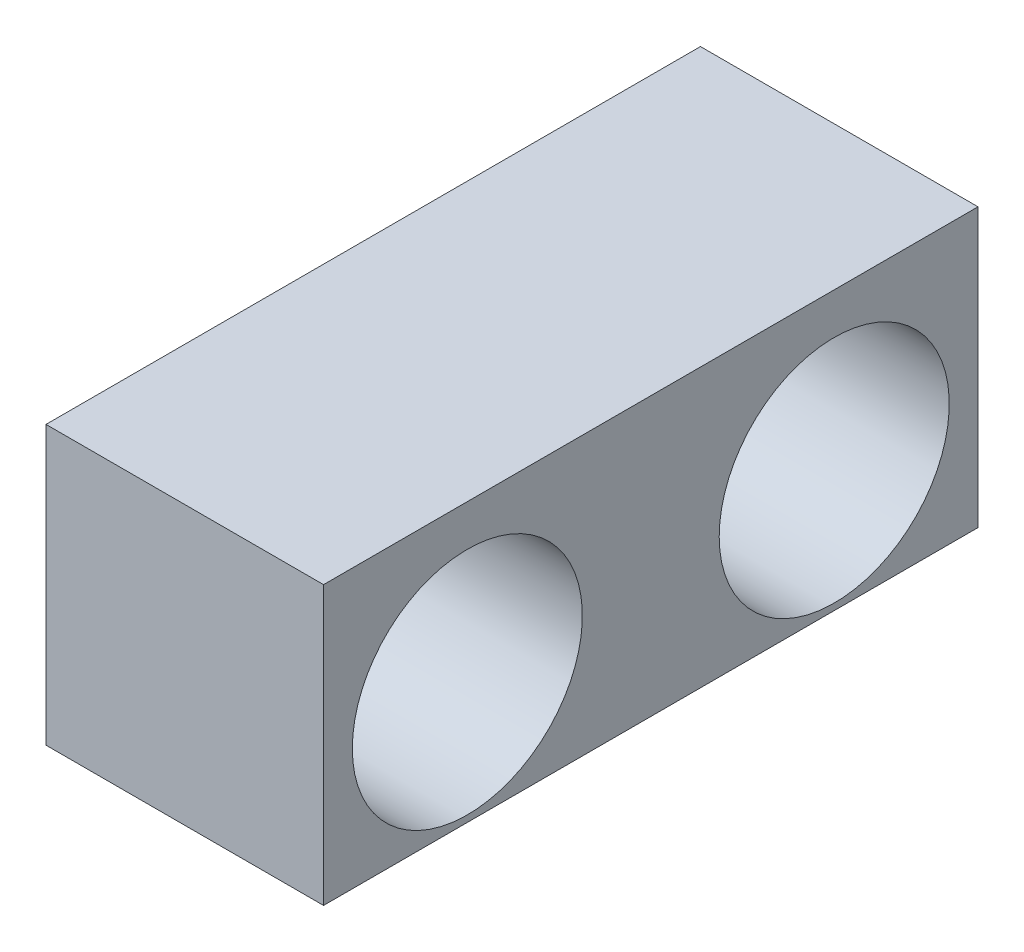
from build123d import *

# Parameters (mm, degrees)
SKETCH1_R           = 75
BOSS_EXTRUDE1_DEPTH = 100
SKETCH2_OUTSIDE_W   = 198.904
SKETCH2_OUTSIDE_H   = 198.904
SKETCH2_OUTSIDE_W_2 = 44.4
SKETCH2_OUTSIDE_H_2 = 104.689862838
CUT_EXTRUDE1_DEPTH  = 146.773797371
SKETCH3_W           = 44.4
SKETCH3_H           = 55.555068581
CUT_EXTRUDE2_DEPTH  = 147.467769086
SKETCH4_R           = 18.4
CUT_EXTRUDE3_DEPTH  = 82.772267757


with BuildPart() as part:
    # Sketch1 → Boss-Extrude1 (new body)
    with BuildSketch(Plane(origin=(0, 0, 0), x_dir=(1, 0, 0), z_dir=(0, 1, 0))):
        Circle(SKETCH1_R)
    extrude(amount=BOSS_EXTRUDE1_DEPTH)

    # Sketch2 outside → Cut-Extrude1 (cut, through all)
    with BuildSketch(Plane(origin=(0, 100, 0), x_dir=(1, 0, 0), z_dir=(0, 1, 0))):
        Rectangle(SKETCH2_OUTSIDE_W, SKETCH2_OUTSIDE_H)
        Rectangle(SKETCH2_OUTSIDE_W_2, SKETCH2_OUTSIDE_H_2, mode=Mode.SUBTRACT)
    extrude(amount=-CUT_EXTRUDE1_DEPTH, mode=Mode.SUBTRACT)

    # Sketch3 → Cut-Extrude2 (cut, through all)
    with BuildSketch(Plane.XY.offset(52.344931419)):
        with Locations((0, 72.222465709)):
            Rectangle(SKETCH3_W, SKETCH3_H)
    extrude(amount=-CUT_EXTRUDE2_DEPTH, mode=Mode.SUBTRACT)

    # Sketch4 → Cut-Extrude3 (cut, through all)
    with BuildSketch(Plane.ZY.offset(22.2)):
        with Locations((29.344931419, 19.444931419)):
            Circle(SKETCH4_R)
        with Locations((-29.344931419, 19.444931419)):
            Circle(SKETCH4_R)
    extrude(amount=-CUT_EXTRUDE3_DEPTH, mode=Mode.SUBTRACT)


solid = part.part
